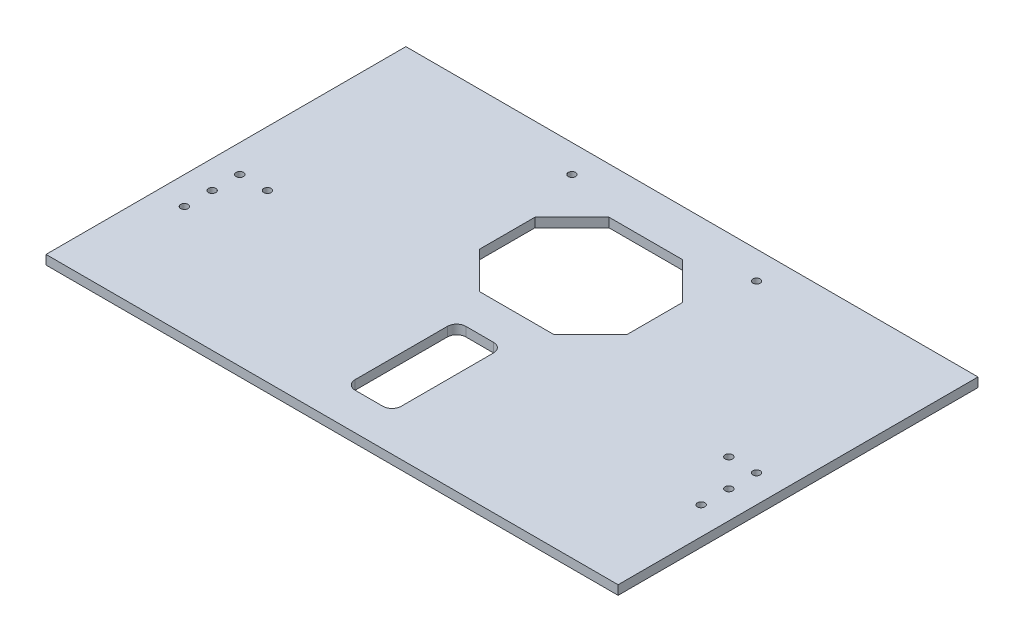
from build123d import *

# Parameters (mm, degrees)
BOSS_EXTRUDE1_DEPTH = 5
SKETCH2_R           = 2
SKETCH2_W           = 25
SKETCH2_H           = 60
CUT_EXTRUDE1_DEPTH  = 213.308737456
FILLET1_R           = 5
SKETCH5_W           = 80
SKETCH5_H           = 70
CUT_EXTRUDE2_DEPTH  = 5
CHAMFER1_SIZE       = 20
SKETCH6_W           = 95
SKETCH6_H           = 95
BOSS_EXTRUDE2_DEPTH = 5


with BuildPart() as part:
    # Sketch1 → Boss-Extrude1 (new body)
    with BuildSketch(Plane(origin=(0, 0, 0), x_dir=(1, 0, 0), z_dir=(0, 1, 0))):
        Polygon((-60, 50), (-155, 50), (-155, -50), (155, -50), (155, 50), (60, 50), (60, 145), (-60, 145), align=None)
    extrude(amount=BOSS_EXTRUDE1_DEPTH)

    # Sketch2 → Cut-Extrude1 (cut, through all)
    with BuildSketch(Plane(origin=(0, 5, 0), x_dir=(1, 0, 0), z_dir=(0, 1, 0))):
        with Locations((-140, 40)):
            Circle(SKETCH2_R)
        with Locations((-125, 40)):
            Circle(SKETCH2_R)
        with Locations((-140, 25)):
            Circle(SKETCH2_R)
        with Locations((-140, 10)):
            Circle(SKETCH2_R)
        with Locations((140, 10)):
            Circle(SKETCH2_R)
        with Locations((140, 25)):
            Circle(SKETCH2_R)
        with Locations((125, 40)):
            Circle(SKETCH2_R)
        with Locations((140, 40)):
            Circle(SKETCH2_R)
        with Locations((-50, 130)):
            Circle(SKETCH2_R)
        with Locations((50, 130)):
            Circle(SKETCH2_R)
        Rectangle(SKETCH2_W, SKETCH2_H)
    extrude(amount=-CUT_EXTRUDE1_DEPTH, mode=Mode.SUBTRACT)

    # Fillet1
    fillet1_edges = [part.edges().sort_by_distance(p)[0] for p in [
        (-12.5, 2.5, 30),
        (12.5, 2.5, -30),
        (12.5, 2.5, 30),
        (-12.5, 2.5, -30),
    ]]
    fillet(fillet1_edges, radius=FILLET1_R)

    # Sketch5 → Cut-Extrude2 (cut)
    with BuildSketch(Plane(origin=(0, 5, 0), x_dir=(1, 0, 0), z_dir=(0, 1, 0))):
        with Locations((0, 85)):
            Rectangle(SKETCH5_W, SKETCH5_H)
    extrude(amount=-CUT_EXTRUDE2_DEPTH, mode=Mode.SUBTRACT)

    # Chamfer1
    chamfer1_edges = [part.edges().sort_by_distance(p)[0] for p in [
        (-40, 2.5, -50),
        (40, 2.5, -50),
        (40, 2.5, -120),
        (-40, 2.5, -120),
    ]]
    chamfer(chamfer1_edges, length=CHAMFER1_SIZE)

    # Sketch6 → Boss-Extrude2 (add)
    with BuildSketch(Plane(origin=(0, 5, 0), x_dir=(1, 0, 0), z_dir=(0, 1, 0))):
        with Locations((107.5, 97.5)):
            Rectangle(SKETCH6_W, SKETCH6_H)
        with Locations((-107.5, 97.5)):
            Rectangle(SKETCH6_W, SKETCH6_H)
    extrude(amount=-BOSS_EXTRUDE2_DEPTH)


solid = part.part
